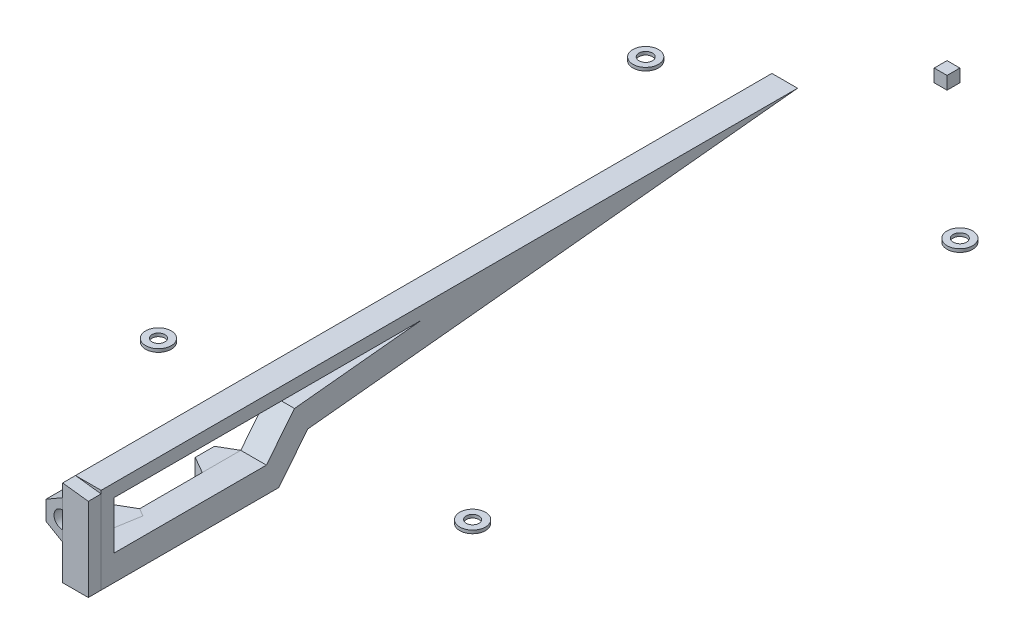
from build123d import *

# Parameters (mm, degrees)
SKETCH_1_W          = 2
SKETCH_1_H          = 2
EXTRUDE_1_DEPTH     = 3
SKETCH_3_W          = 6.103798984
SKETCH_3_H          = 7.216344691
CUT_EXTRUDE_1_DEPTH = 100
EXTRUDE_3_DEPTH     = 2
EXTRUDE_4_DEPTH     = 4
EXTRUDE_6_DEPTH     = 4
EXTRUDE_6_2_DEPTH   = 4
EXTRUDE_7_DEPTH     = 4
SKETCH_14_R         = 1.35
CUT_EXTRUDE_7_DEPTH = 4
SKETCH_16_R         = 2
SKETCH_16_R_2       = 1
EXTRUDE_8_DEPTH     = 0.5
EXTRUDE_8_2_DEPTH   = 0.5
SKETCH_16_R_3       = 1.05
EXTRUDE_8_3_DEPTH   = 0.5
SKETCH_16_R_4       = 1.050016024
EXTRUDE_8_4_DEPTH   = 0.5


with BuildPart() as part:
    # 草图1 → 凸台-拉伸1 (new body)
    with BuildSketch(Plane(origin=(0, 0, 0), x_dir=(1, 0, 0), z_dir=(0, 1, 0))):
        Rectangle(SKETCH_1_W, SKETCH_1_H)
    extrude(amount=EXTRUDE_1_DEPTH)

    # 草图3 → 切除-拉伸1 (cut)
    with BuildSketch(Plane.XZ.offset(-1)):
        with Locations((-0.416327581, 1.421882079)):
            Rectangle(SKETCH_3_W, SKETCH_3_H)
    extrude(amount=CUT_EXTRUDE_1_DEPTH, mode=Mode.SUBTRACT)


with BuildPart() as body_2:
    # 草图7 → 凸台-拉伸3 (new body)
    with BuildSketch(Plane.XY.offset(123.5)):
        Polygon((-14.439249429, 1.487804878), (-10.439249429, 1), (-10.439249429, -12), (-14.439249429, -12), (-14.439249429, 1), align=None)
    extrude(amount=-EXTRUDE_3_DEPTH)


with BuildPart() as body_3:
    # 草图8 → 凸台-拉伸4 (new body)
    with BuildSketch(Plane.ZY.offset(14.439249429)):
        Polygon((12.875917511, 1.487804878), (121.5, 1.487804878), (121.5, -12), (93.804336039, -12), (89.267540672, -6.347268376), align=None)
        Polygon((71.5802488, -0.512195122), (119.5, -0.512195122), (119.5, -8), (106.737581435, -8), (95.722961725, -8), (92.704938742, -4.239620134), (91.339916161, -2.53883672), align=None, mode=Mode.SUBTRACT)
    extrude(amount=-EXTRUDE_4_DEPTH)


with BuildPart() as body_4:
    # 草图11 → 凸台-拉伸6 (new body)
    with BuildSketch(Plane.XZ.offset(12)):
        Polygon((-17.03732564, 97.222961725), (-14.439249429, 95.722961725), (-14.439249429, 101.722961725), (-17.03732564, 100.222961725), align=None)
    extrude(amount=-EXTRUDE_6_DEPTH)


with BuildPart() as body_5:
    # 草图11 → Extrude 6 2 (new body)
    with BuildSketch(Plane.XZ.offset(12)):
        Polygon((-11.841173217, 116), (-14.439249429, 117.5), (-17.03732564, 116), (-17.03732564, 113), (-14.439249429, 111.5), (-11.841173217, 113), align=None)
    extrude(amount=-EXTRUDE_6_2_DEPTH)


with BuildPart() as body_6:
    # 草图13 → 凸台-拉伸7 (new body)
    with BuildSketch(Plane.XY.offset(123.5)):
        Polygon((-11.841173217, -2.012195122), (-14.439249429, -0.512195122), (-17.03732564, -2.012195122), (-17.03732564, -5.012195122), (-14.439249429, -6.512195122), (-11.841173217, -5.012195122), align=None)
    extrude(amount=-EXTRUDE_7_DEPTH)

    # 草图14 → 切除-拉伸7 (cut)
    with BuildSketch(Plane.XY.offset(123.5)):
        with Locations((-14.439249429, -3.512195122)):
            Circle(SKETCH_14_R)
    extrude(amount=-CUT_EXTRUDE_7_DEPTH, mode=Mode.SUBTRACT)


with BuildPart() as body_7:
    # 草图16 → 凸台-拉伸8 (new body)
    with BuildSketch(Plane(origin=(0, 3, 0), x_dir=(1, 0, 0), z_dir=(0, 1, 0))):
        with Locations((24, -97.999988001)):
            Circle(SKETCH_16_R)
        with Locations((24, -97.999988001)):
            Circle(SKETCH_16_R_2, mode=Mode.SUBTRACT)
    extrude(amount=-EXTRUDE_8_DEPTH)


with BuildPart() as body_8:
    # 草图16 → Extrude 8 2 (new body)
    with BuildSketch(Plane(origin=(0, 3, 0), x_dir=(1, 0, 0), z_dir=(0, 1, 0))):
        with Locations((-24.999894002, -97.999988001)):
            Circle(SKETCH_16_R)
        with Locations((-24.999894002, -97.999988001)):
            Circle(SKETCH_16_R_2, mode=Mode.SUBTRACT)
    extrude(amount=-EXTRUDE_8_2_DEPTH)


with BuildPart() as body_9:
    # 草图16 → Extrude 8 3 (new body)
    with BuildSketch(Plane(origin=(0, 3, 0), x_dir=(1, 0, 0), z_dir=(0, 1, 0))):
        with Locations((-24.999894002, -21.999986001)):
            Circle(SKETCH_16_R)
        with Locations((-24.999894002, -21.999986001)):
            Circle(SKETCH_16_R_3, mode=Mode.SUBTRACT)
    extrude(amount=-EXTRUDE_8_3_DEPTH)


with BuildPart() as body_10:
    # 草图16 → Extrude 8 4 (new body)
    with BuildSketch(Plane(origin=(0, 3, 0), x_dir=(1, 0, 0), z_dir=(0, 1, 0))):
        with Locations((24, -21.999986001)):
            Circle(SKETCH_16_R)
        with Locations((24, -21.999986001)):
            Circle(SKETCH_16_R_4, mode=Mode.SUBTRACT)
    extrude(amount=-EXTRUDE_8_4_DEPTH)


solid = Compound([part.part, body_2.part, body_3.part, body_4.part, body_5.part, body_6.part, body_7.part, body_8.part, body_9.part, body_10.part])
